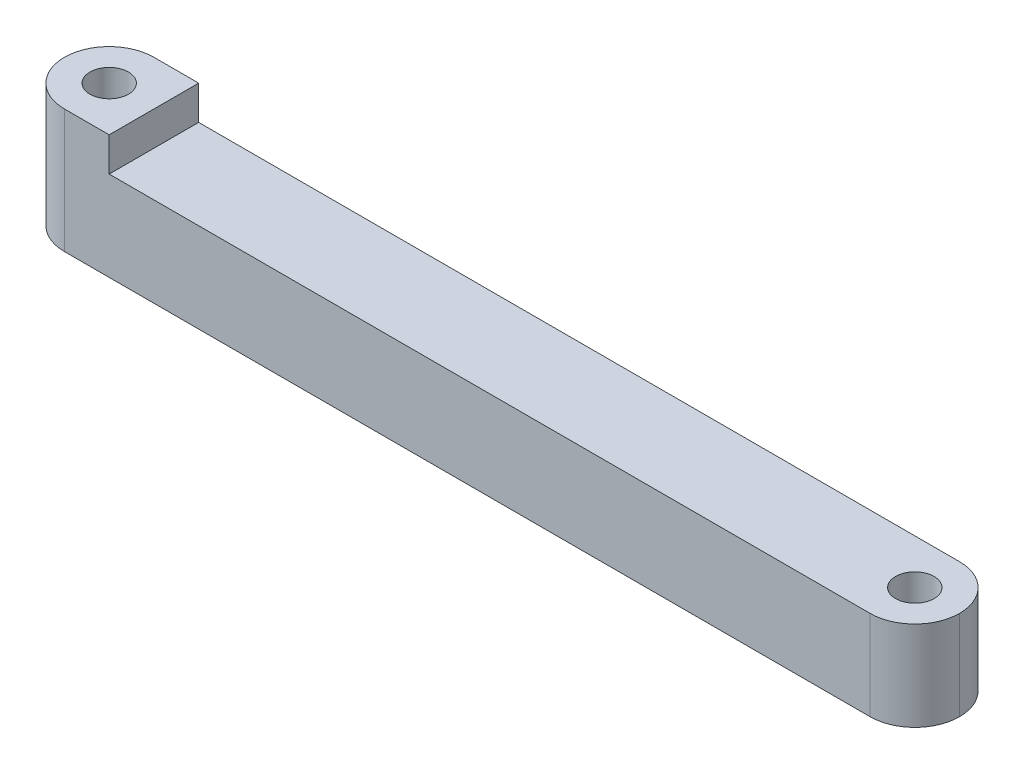
from build123d import *

# Parameters (mm, degrees)
SKETCH_1_W          = 100
SKETCH_1_H          = 10
EXTRUDE_1_DEPTH     = 10
SKETCH_4_W          = 10
SKETCH_4_H          = 10
EXTRUDE_2_DEPTH     = 3.8
FILLET_1_R          = 5
SKETCH_2_R          = 2.15
CUT_EXTRUDE_1_DEPTH = 53.824615474


with BuildPart() as part:
    # 스케치1 → 보스-돌출1 (new body)
    with BuildSketch(Plane.XY):
        Rectangle(SKETCH_1_W, SKETCH_1_H)
    extrude(amount=EXTRUDE_1_DEPTH)

    # 스케치4 → 보스-돌출2 (add)
    with BuildSketch(Plane(origin=(0, 5, 0), x_dir=(1, 0, 0), z_dir=(0, 1, 0))):
        with Locations((-45, -5)):
            Rectangle(SKETCH_4_W, SKETCH_4_H)
    extrude(amount=EXTRUDE_2_DEPTH)

    # 필렛1
    fillet_1_edges = [part.edges().sort_by_distance(p)[0] for p in [
        (50, 0, 0),
        (50, 0, 10),
        (-50, 1.9, 0),
        (-50, 1.9, 10),
    ]]
    fillet(fillet_1_edges, radius=FILLET_1_R - 0.0001)  # a hair under: the kernel refuses the full size

    # 스케치2 → 컷-돌출1 (cut, through all)
    with BuildSketch(Plane(origin=(0, 8.8, 0), x_dir=(1, 0, 0), z_dir=(0, 1, 0))):
        with Locations(Location((-45, -5, 0), (0, 0, 270))):
            Circle(SKETCH_2_R)
        with Locations(Location((45, -5, 0), (0, 0, 270))):
            Circle(SKETCH_2_R)
    extrude(amount=-CUT_EXTRUDE_1_DEPTH, mode=Mode.SUBTRACT)


solid = part.part
